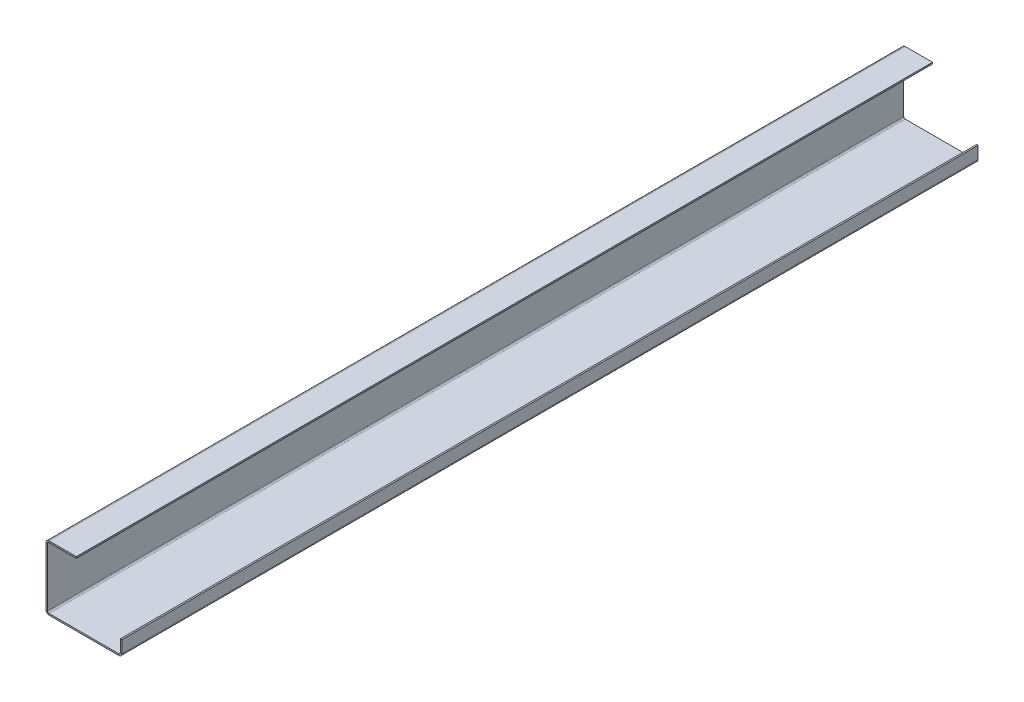
from build123d import *

# Parameters (mm, degrees)
BASE_FLANGE1_DEPTH = 1130


# Sheet-metal steps are written as plain solids
with BuildPart() as part:
    # Sketch1 → Base-Flange1 (new body)
    with BuildSketch(Plane.XY):
        with BuildLine():
            Line((40, 85), (4, 85))
            ThreePointArc((4, 85), (1.171572875, 83.828427125), (0, 81))
            Line((0, 81), (0, 4))
            ThreePointArc((0, 4), (1.171572875, 1.171572875), (4, 0))
            Line((4, 0), (96, 0))
            ThreePointArc((96, 0), (98.828427125, 1.171572875), (100, 4))
            Line((100, 4), (100, 20))
            Line((100, 20), (98, 20))
            Line((98, 20), (98, 4))
            ThreePointArc((98, 4), (97.414213562, 2.585786438), (96, 2))
            Line((96, 2), (4, 2))
            ThreePointArc((4, 2), (2.585786438, 2.585786438), (2, 4))
            Line((2, 4), (2, 81))
            ThreePointArc((2, 81), (2.585786438, 82.414213562), (4, 83))
            Line((4, 83), (40, 83))
            Line((40, 83), (40, 85))
        make_face()
    extrude(amount=BASE_FLANGE1_DEPTH)


solid = part.part
